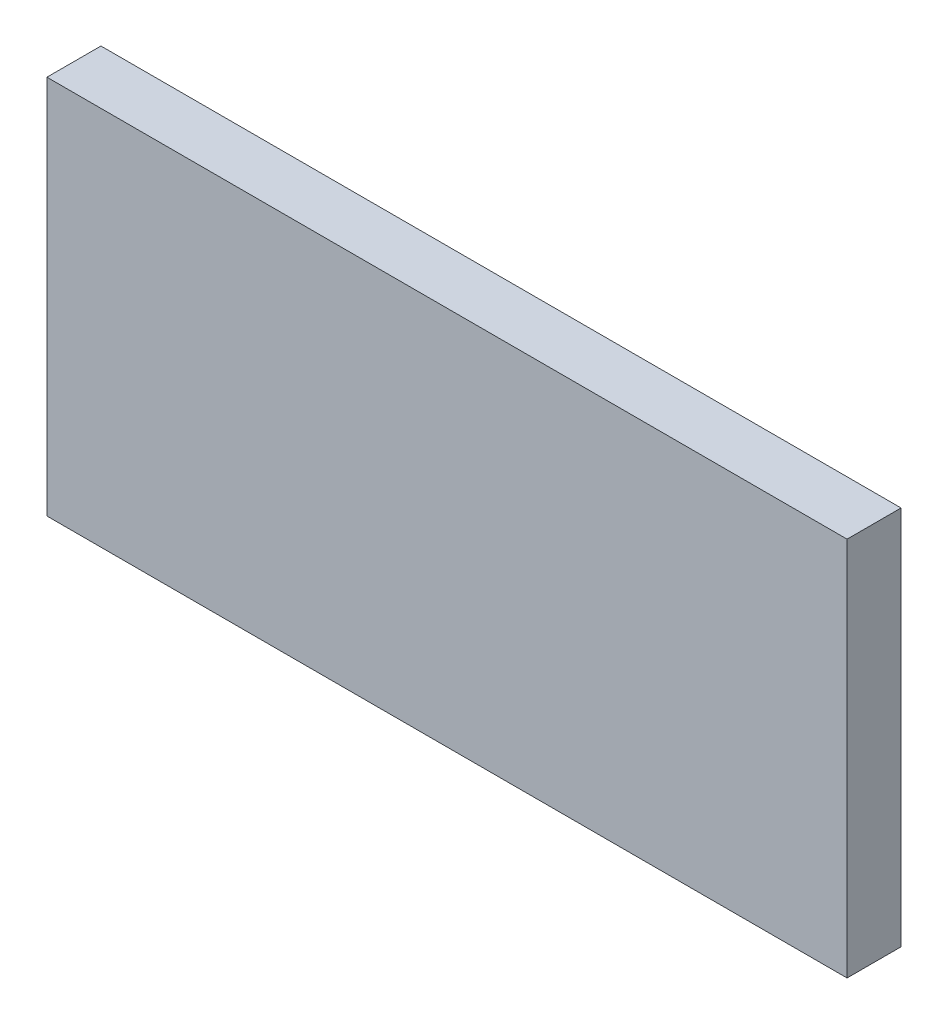
from build123d import *

# Parameters (mm, degrees)
ESQUISSE1_W        = 400
ESQUISSE1_H        = 190
BOSS_EXTRU_1_DEPTH = 27


with BuildPart() as part:
    # Esquisse1 → Boss.-Extru.1 (new body)
    with BuildSketch(Plane.XY):
        with Locations((200, 95)):
            Rectangle(ESQUISSE1_W, ESQUISSE1_H)
    extrude(amount=BOSS_EXTRU_1_DEPTH)


solid = part.part
